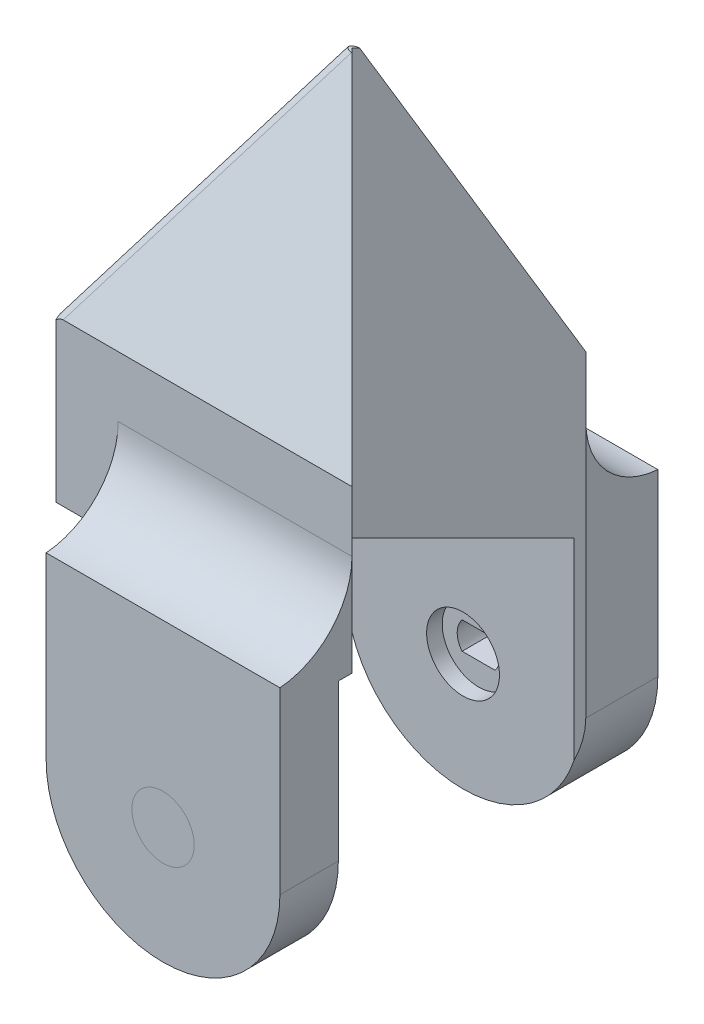
from build123d import *

# Parameters (mm, degrees)
BOSS_EXTRUDE1_DEPTH      = 20.95
BOSS_EXTRUDE2_START      = -9.05
BOSS_EXTRUDE2_DEPTH      = 9.05
SKETCH6_R                = 2
CUT_EXTRUDE2_DEPTH       = 10
CUT_EXTRUDE3_DEPTH       = 2.75
CUT_EXTRUDE4_DEPTH       = 67.499081444
CUT_EXTRUDE4_DEPTH_BACK  = 67.499081444
SKETCH8_W                = 8.290514233
SKETCH8_H                = 3.25
SKETCH11_R               = 11.15
BEARING_HOLE_DEPTH       = 7.3
SKETCH12_W               = 46
SKETCH12_H               = 30
BOSS_EXTRUDE3_DEPTH      = 0.0001
BOSS_EXTRUDE4_DEPTH      = 9.25
BOSS_EXTRUDE4_DEPTH_BACK = 39.25
SKETCH14_W               = 31
SKETCH14_H               = 35
CUT_EXTRUDE5_DEPTH       = 74.138005393
SKETCH15_R               = 4
CUT_EXTRUDE6_DEPTH       = 77.644489906
SKETCH17_R               = 6.169612062
BOSS_EXTRUDE5_DEPTH      = 10
SKETCH18_R               = 4
BOSS_EXTRUDE6_DEPTH      = 14
SKETCH19_R               = 4.675
CUT_EXTRUDE7_DEPTH       = 2
BOSS_EXTRUDE7_START      = -39.25
SKETCH20_W               = 30
SKETCH20_H               = 3
BOSS_EXTRUDE7_DEPTH      = 48.5
FILLET1_R                = 10
SKETCH22_W               = 17.22069039
SKETCH22_H               = 30
CUT_EXTRUDE8_DEPTH       = 67.589629634
SKETCH25_W               = 38.779549847
SKETCH25_H               = 44.55932685
CUT_EXTRUDE10_DEPTH      = 72.152584865
BOSS_EXTRUDE9_DEPTH      = 40
CUT_EXTRUDE11_DEPTH      = 73.945914552
CUT_EXTRUDE12_DEPTH      = 71.955119264
CUT_EXTRUDE13_DEPTH      = 63.342538471
FILLET2_R                = 1


with BuildPart() as part:
    # Sketch2 → Boss-Extrude1 (new body)
    with BuildSketch(Plane.XY):
        with BuildLine():
            Line((-14.709485767, 40), (-23, 40))
            Line((-23, 40), (-23, 0))
            Line((-23, 0), (23, 0))
            Line((23, 0), (23, 40))
            Line((23, 40), (14.709485767, 40))
            ThreePointArc((14.709485767, 40), (0, 54.709485767), (-14.709485767, 40))
        make_face()
        with BuildLine():
            Line((-7.55, 18.241114036), (-7.55, 14.75))
            Line((-7.55, 14.75), (7.55, 14.75))
            Line((7.55, 14.75), (7.55, 18.241114036))
            Line((7.55, 18.241114036), (9.25, 18.241114036))
            Line((9.25, 18.241114036), (9.25, 21.160258306))
            ThreePointArc((9.25, 21.160258306), (0, 46.25), (-9.25, 21.160258306))
            Line((-9.25, 21.160258306), (-9.25, 18.241114036))
            Line((-9.25, 18.241114036), (-7.55, 18.241114036))
        make_face(mode=Mode.SUBTRACT)
    extrude(amount=BOSS_EXTRUDE1_DEPTH)

    # Sketch3 → Boss-Extrude2 (add)
    with BuildSketch(Plane.XY.offset(BOSS_EXTRUDE2_START)):
        with BuildLine():
            Line((-14.709485767, 40), (-23, 40))
            Line((-23, 40), (-23, 0))
            Line((-23, 0), (23, 0))
            Line((23, 0), (23, 40))
            Line((23, 40), (14.709485767, 40))
            ThreePointArc((14.709485767, 40), (0, 54.709485767), (-14.709485767, 40))
        make_face()
    extrude(amount=BOSS_EXTRUDE2_DEPTH)

    # Sketch6 → Cut-Extrude2 (cut)
    with BuildSketch(Plane.XY.offset(20.95)):
        with Locations((-17.5, 32)):
            Circle(SKETCH6_R)
        with Locations((17.5, 32)):
            Circle(SKETCH6_R)
    extrude(amount=-CUT_EXTRUDE2_DEPTH, mode=Mode.SUBTRACT)

    # Sketch7 → Cut-Extrude3 (cut)
    with BuildSketch(Plane.XY.offset(20.95)):
        with BuildLine():
            Line((-17.5, 35.75), (17.5, 35.75))
            ThreePointArc((17.5, 35.75), (21.25, 32), (17.5, 28.25))
            Line((17.5, 28.25), (-17.5, 28.25))
            ThreePointArc((-17.5, 28.25), (-21.25, 32), (-17.5, 35.75))
        make_face()
    extrude(amount=-CUT_EXTRUDE3_DEPTH, mode=Mode.SUBTRACT)

    # Sketch8 → Cut-Extrude4 (cut, two sides: drawn at the far end of the back side and taken through both)
    with BuildSketch(Plane.XY.offset(20.95).offset(-CUT_EXTRUDE4_DEPTH_BACK)):
        with Locations((-18.854742884, 38.375)):
            Rectangle(SKETCH8_W, SKETCH8_H)
        with Locations((18.854742884, 38.375)):
            Rectangle(SKETCH8_W, SKETCH8_H)
    extrude(amount=CUT_EXTRUDE4_DEPTH + CUT_EXTRUDE4_DEPTH_BACK, mode=Mode.SUBTRACT)

    # Sketch11 → Bearing Hole (cut)
    with BuildSketch(Plane(origin=(0, 0, -9.05), x_dir=(-1, 0, 0), z_dir=(0, 0, -1))):
        with Locations((0, 40)):
            Circle(SKETCH11_R)
    extrude(amount=-BEARING_HOLE_DEPTH, mode=Mode.SUBTRACT)

    # Sketch12 → Boss-Extrude3 (add)
    with BuildSketch(Plane.XZ):
        with Locations((0, 5.95)):
            Rectangle(SKETCH12_W, SKETCH12_H)
    extrude(amount=BOSS_EXTRUDE3_DEPTH)

    # Sketch13 → Boss-Extrude4 (add, two sides: drawn at the far end of the back side and taken through both)
    with BuildSketch(Plane.XY.offset(20.95).offset(-BOSS_EXTRUDE4_DEPTH_BACK)):
        with BuildLine():
            Line((-15, -0.0001), (15, -0.0001))
            Line((15, -0.0001), (15, -20.0001))
            ThreePointArc((15, -20.0001), (0, -35.0001), (-15, -20.0001))
            Line((-15, -20.0001), (-15, -0.0001))
        make_face()
    extrude(amount=BOSS_EXTRUDE4_DEPTH + BOSS_EXTRUDE4_DEPTH_BACK)

    # Sketch14 → Cut-Extrude5 (cut, through all)
    with BuildSketch(Plane.ZY.offset(15)):
        with Locations((7.2, -17.5001)):
            Rectangle(SKETCH14_W, SKETCH14_H)
    extrude(amount=-CUT_EXTRUDE5_DEPTH, mode=Mode.SUBTRACT)


with BuildPart() as cut_extrude5_piece_1:
    # of the separate pieces the step leaves, piece 1, a body of its own (cut_extrude5_pieces)
    add(part.part.solids().sort_by_distance((14.709485767, 40, 20.95))[0])


with BuildPart() as cut_extrude5_piece_2:
    # of the separate pieces the step leaves, piece 2, a body of its own (cut_extrude5_pieces)
    add(part.part.solids().sort_by_distance((-15, -0.0001, 30.2))[0])


with BuildPart() as cut_extrude6_tool:
    # Sketch15 → Cut-Extrude6 (new, through all)
    with BuildSketch(Plane.XY.offset(30.2)):
        with Locations((0, -20.0001)):
            Circle(SKETCH15_R)
    extrude(amount=-CUT_EXTRUDE6_DEPTH)


with BuildPart() as cut_extrude5_piece_1_1:
    add(cut_extrude5_piece_1.part)

    # Cut-Extrude6: cut by cut_extrude6_tool
    add(cut_extrude6_tool.part, mode=Mode.SUBTRACT)

    # Sketch17 → Boss-Extrude5 (add)
    with BuildSketch(Plane(origin=(0, 0, -18.3), x_dir=(-1, 0, 0), z_dir=(0, 0, -1))):
        with Locations((0, -20.0001)):
            Circle(SKETCH17_R)
        with BuildLine():
            Line((-2.121320344, -18.2501), (2.121320344, -18.2501))
            ThreePointArc((2.121320344, -18.2501), (2.75, -20.0001), (2.121320344, -21.7501))
            Line((2.121320344, -21.7501), (-2.121320344, -21.7501))
            ThreePointArc((-2.121320344, -21.7501), (-2.75, -20.0001), (-2.121320344, -18.2501))
        make_face(mode=Mode.SUBTRACT)
    extrude(amount=-BOSS_EXTRUDE5_DEPTH)

    # Sketch19 → Cut-Extrude7 (cut)
    with BuildSketch(Plane.XY.offset(-8.3)):
        with Locations((0, -20.0001)):
            Circle(SKETCH19_R)
    extrude(amount=-CUT_EXTRUDE7_DEPTH, mode=Mode.SUBTRACT)



with BuildPart() as cut_extrude5_piece_2_1:
    add(cut_extrude5_piece_2.part)

    # Cut-Extrude6: cut by cut_extrude6_tool
    add(cut_extrude6_tool.part, mode=Mode.SUBTRACT)


with BuildPart() as body_3:
    # Sketch18 → Boss-Extrude6 (new body)
    with BuildSketch(Plane.XY.offset(30.2)):
        with Locations((0, -20.0001)):
            Circle(SKETCH18_R)
    extrude(amount=-BOSS_EXTRUDE6_DEPTH)


with BuildPart() as cut_extrude5_piece_1_2:
    add(cut_extrude5_piece_1_1.part)

    add(cut_extrude5_piece_2_1.part)  # Boss-Extrude7 merges Cut-Extrude5 piece 2
    # Sketch20 → Boss-Extrude7 (add)
    with BuildSketch(Plane.XY.offset(20.95).offset(BOSS_EXTRUDE7_START)):
        with Locations((0, 1.4999)):
            Rectangle(SKETCH20_W, SKETCH20_H)
    extrude(amount=BOSS_EXTRUDE7_DEPTH)

    # Fillet1
    # the kernel refuses this fillet: 10 mm, written as the material it adds along each edge
    with BuildSketch(Plane(origin=(-15, 2.9999, 20.95), x_dir=(0, 1, 0), z_dir=(1, 0, 0))) as fillet1_piece_1:
        with BuildLine():
            CenterArc((9.971835338, 10), FILLET1_R, 184.301222305, 85.698777695)
            Line((0, 9.25), (-0.199436707, 9.235))
            ThreePointArc((-0.199436707, 9.235), (-0.2, 4.625), (-0.2, 0))
            Line((-0.2, 0), (0, -0.2))
            Line((0, -0.2), (9.971835338, -0.2))
            Line((9.971835338, -0.2), (9.971835338, 0))
        make_face()
    extrude(amount=30)
    with BuildSketch(Plane(origin=(-15, 2.9999, -9.05), x_dir=(0, 0, -1), z_dir=(1, 0, 0))) as fillet1_piece_2:
        with BuildLine():
            CenterArc((10, 9.971835338), FILLET1_R, 180, 85.698777695)
            Line((0, 9.971835338), (-0.2, 9.971835338))
            Line((-0.2, 9.971835338), (-0.2, 0))
            Line((-0.2, 0), (0, -0.2))
            ThreePointArc((0, -0.2), (4.625, -0.2), (9.235, -0.199436707))
            Line((9.235, -0.199436707), (9.25, 0))
        make_face()
    extrude(amount=30)

    # Sketch22 → Cut-Extrude8 (cut, through all)
    with BuildSketch(Plane.XZ.offset(0.0001)):
        with Locations((23.610345195, 5.95)):
            Rectangle(SKETCH22_W, SKETCH22_H)
    extrude(amount=-CUT_EXTRUDE8_DEPTH, mode=Mode.SUBTRACT)

    # Sketch25 → Cut-Extrude10 (cut, through all)
    with BuildSketch(Plane(origin=(0, 0, -9.05), x_dir=(-1, 0, 0), z_dir=(0, 0, -1))):
        with Locations((3.610225076, 36.732087153)):
            Rectangle(SKETCH25_W, SKETCH25_H)
    extrude(amount=-CUT_EXTRUDE10_DEPTH, mode=Mode.SUBTRACT)

    # Sketch38 → Boss-Extrude9 (add)
    with BuildSketch(Plane(origin=(0, 14.452423728, 0), x_dir=(1, 0, 0), z_dir=(0, 1, 0))):
        Polygon((15, 9.05), (0, -5.95), (15, -20.95), (-23, -20.95), (-23, 9.05), align=None)
    extrude(amount=BOSS_EXTRUDE9_DEPTH)

    # Sketch39 → Cut-Extrude11 (cut, through all)
    with BuildSketch(Plane.ZY.offset(23)):
        Polygon((6.45, 54.452423728), (20.95, 54.452423728), (20.95, 20.728867261), align=None)
        Polygon((-9.05, 54.452423728), (-9.05, 20.728867261), (5.45, 54.452423728), align=None)
    extrude(amount=-CUT_EXTRUDE11_DEPTH, mode=Mode.SUBTRACT)

    # Sketch40 → Cut-Extrude12 (cut, through all)
    with BuildSketch(Plane.XY.offset(20.95)):
        Polygon((-23, 54.452423728), (-0.5, 54.452423728), (-23, 20.728867261), align=None)
    extrude(amount=-CUT_EXTRUDE12_DEPTH, mode=Mode.SUBTRACT)

    # Sketch41 → Cut-Extrude13 (cut, through all)
    with BuildSketch(Plane(origin=(0, 14.452423728, 0), x_dir=(1, 0, 0), z_dir=(0, 1, 0))):
        Polygon((15, 9.05), (0, -5.95), (15, -20.95), align=None)
    extrude(amount=-CUT_EXTRUDE13_DEPTH, mode=Mode.SUBTRACT)

    # Fillet2
    # the kernel refuses this fillet: 1 mm, written as the material it takes off along each edge
    with BuildSketch(Plane(origin=(0.545475798, 56.01940871, 5.77624893), x_dir=(-0.18691021617579237, -0.2801456546378411, -0.9415853563414492), z_dir=(-0.5225810121185461, -0.7832573453532435, 0.3367744300319518)), Plane(origin=(0.545475798, 56.01940871, 6.12375107), x_dir=(0.8525896350373701, -0.4800849077481965, -0.20642043401574758), z_dir=(-0.5225810121185461, -0.7832573453532435, -0.3367744300319518))) as fillet2_piece_1:
        with BuildLine():
            CenterArc((FILLET2_R * 0.800240172067, FILLET2_R), FILLET2_R, 192.663603939, 77.336396061)
            Line((-FILLET2_R * 0.175433828194, FILLET2_R * 0.78077352985), (0, 0))
            Line((0, 0), (FILLET2_R * 0.800240172067, 0))
        make_face()
    extrude(amount=47.056726182, mode=Mode.SUBTRACT)


solid = Compound([body_3.part, cut_extrude5_piece_1_2.part])
